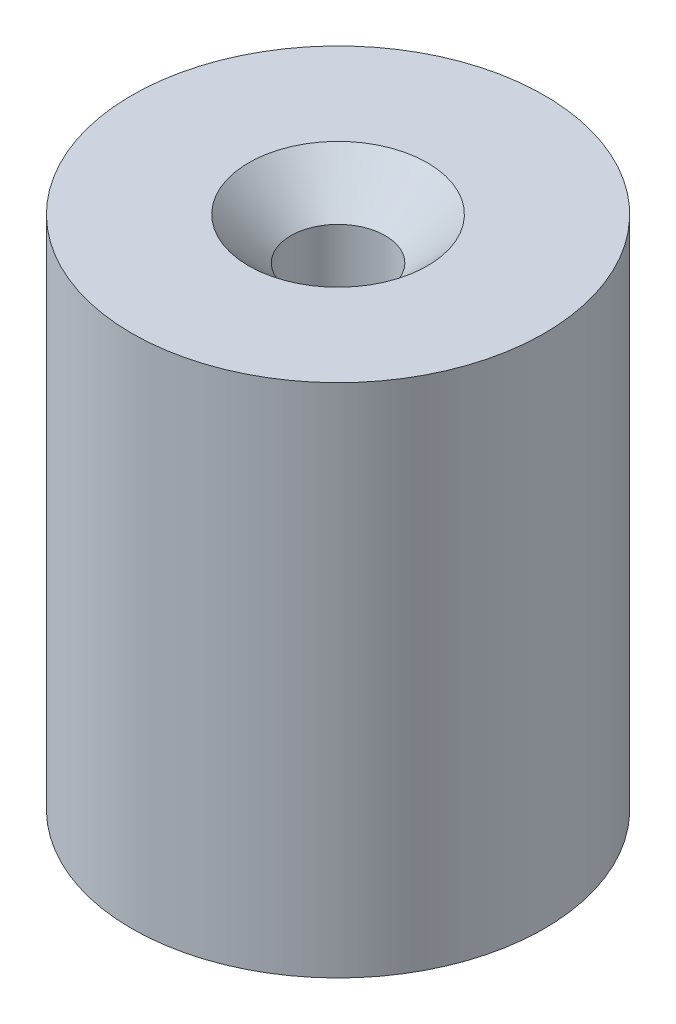
from build123d import *

# Parameters (mm, degrees)
SKETCH1_R                                           = 12
BOSS_EXTRUDE1_DEPTH                                 = 30
CSK_FOR_M5_COUNTERSUNK_FLAT_HEAD_SCREW1_D           = 5.5
CSK_FOR_M5_COUNTERSUNK_FLAT_HEAD_SCREW1_DEPTH       = 12
CSK_FOR_M5_COUNTERSUNK_FLAT_HEAD_SCREW1_CSINK_D     = 10.4
CSK_FOR_M5_COUNTERSUNK_FLAT_HEAD_SCREW1_CSINK_ANGLE = 90
CSK_FOR_M5_COUNTERSUNK_FLAT_HEAD_SCREW1_TIP         = 1.652366702
F_8_0MM_DOWEL_HOLE1_D                               = 8
F_8_0MM_DOWEL_HOLE1_DEPTH                           = 12
F_8_0MM_DOWEL_HOLE1_TIP                             = 2.403442476


with BuildPart() as part:
    # Sketch1 → Boss-Extrude1 (new body)
    with BuildSketch(Plane(origin=(0, 0, 0), x_dir=(1, 0, 0), z_dir=(0, 1, 0))):
        Circle(SKETCH1_R)
    extrude(amount=BOSS_EXTRUDE1_DEPTH)

    # CSK for M5 Countersunk Flat Head Screw1
    with Locations(Plane(origin=(0, 30, 0), x_dir=(1, 0, 0), z_dir=(0, 1, 0))):
        with Locations((0, 0)):
            CounterSinkHole(CSK_FOR_M5_COUNTERSUNK_FLAT_HEAD_SCREW1_D / 2, CSK_FOR_M5_COUNTERSUNK_FLAT_HEAD_SCREW1_CSINK_D / 2, depth=CSK_FOR_M5_COUNTERSUNK_FLAT_HEAD_SCREW1_DEPTH, counter_sink_angle=CSK_FOR_M5_COUNTERSUNK_FLAT_HEAD_SCREW1_CSINK_ANGLE)
            with Locations((0, 0, -(CSK_FOR_M5_COUNTERSUNK_FLAT_HEAD_SCREW1_DEPTH + CSK_FOR_M5_COUNTERSUNK_FLAT_HEAD_SCREW1_TIP / 2))):  # 118° drill point
                Cone(0, CSK_FOR_M5_COUNTERSUNK_FLAT_HEAD_SCREW1_D / 2, CSK_FOR_M5_COUNTERSUNK_FLAT_HEAD_SCREW1_TIP, mode=Mode.SUBTRACT)

    # Ø8.0mm Dowel Hole1
    with Locations(Plane(origin=(0, 0, 0), x_dir=(-1, 0, 0), z_dir=(0, -1, 0))):
        with Locations((0, 0)):
            Hole(F_8_0MM_DOWEL_HOLE1_D / 2, depth=F_8_0MM_DOWEL_HOLE1_DEPTH)
            with Locations((0, 0, -(F_8_0MM_DOWEL_HOLE1_DEPTH + F_8_0MM_DOWEL_HOLE1_TIP / 2))):  # 118° drill point
                Cone(0, F_8_0MM_DOWEL_HOLE1_D / 2, F_8_0MM_DOWEL_HOLE1_TIP, mode=Mode.SUBTRACT)


solid = part.part
